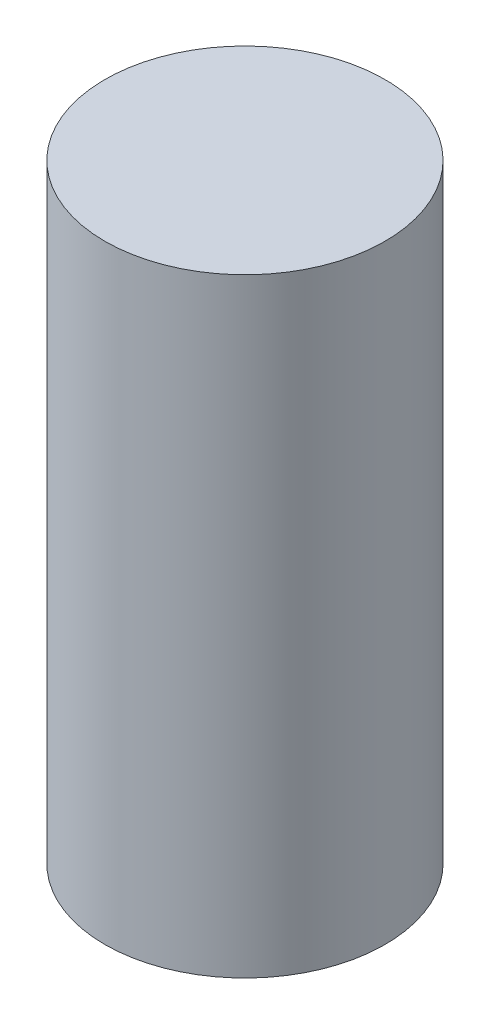
from build123d import *

# Parameters (mm, degrees)
ESQUISSE1_R        = 73.61
BOSS_EXTRU_1_DEPTH = 320


with BuildPart() as part:
    # Esquisse1 → Boss.-Extru.1 (new body)
    with BuildSketch(Plane(origin=(0, 0, 0), x_dir=(1, 0, 0), z_dir=(0, 1, 0))):
        Circle(ESQUISSE1_R)
    extrude(amount=BOSS_EXTRU_1_DEPTH)


solid = part.part
